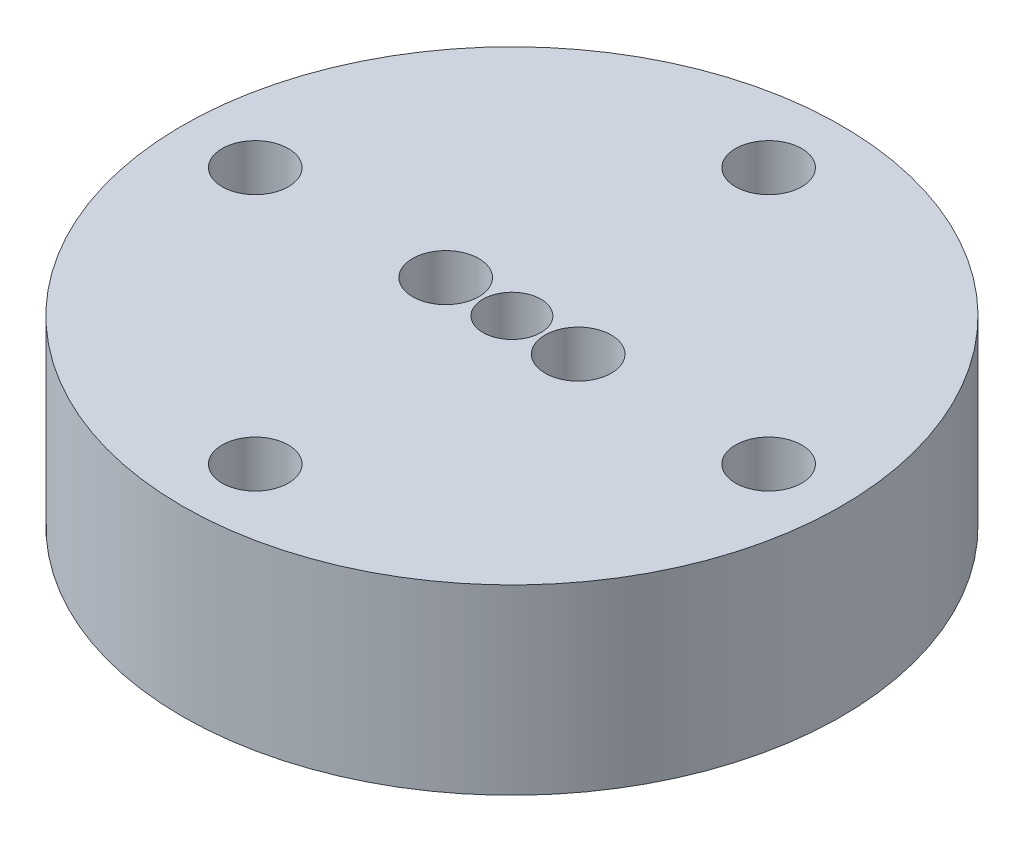
from build123d import *

# Parameters (mm, degrees)
SKETCH1_R           = 19.9
SKETCH1_R_2         = 2
SKETCH1_R_3         = 1.75
BOSS_EXTRUDE1_DEPTH = 11


with BuildPart() as part:
    # Sketch1 → Boss-Extrude1 (new body)
    with BuildSketch(Plane(origin=(0, 0, 0), x_dir=(1, 0, 0), z_dir=(0, 1, 0))):
        Circle(SKETCH1_R)
        with Locations((0, 15.5)):
            Circle(SKETCH1_R_2, mode=Mode.SUBTRACT)
        with Locations((15.5, 0)):
            Circle(SKETCH1_R_2, mode=Mode.SUBTRACT)
        with Locations((0, -15.5)):
            Circle(SKETCH1_R_2, mode=Mode.SUBTRACT)
        with Locations((-15.5, 0)):
            Circle(SKETCH1_R_2, mode=Mode.SUBTRACT)
        with Locations((-4, 0)):
            Circle(SKETCH1_R_2, mode=Mode.SUBTRACT)
        with Locations((4, 0)):
            Circle(SKETCH1_R_2, mode=Mode.SUBTRACT)
        Circle(SKETCH1_R_3, mode=Mode.SUBTRACT)
    extrude(amount=BOSS_EXTRUDE1_DEPTH)


solid = part.part
